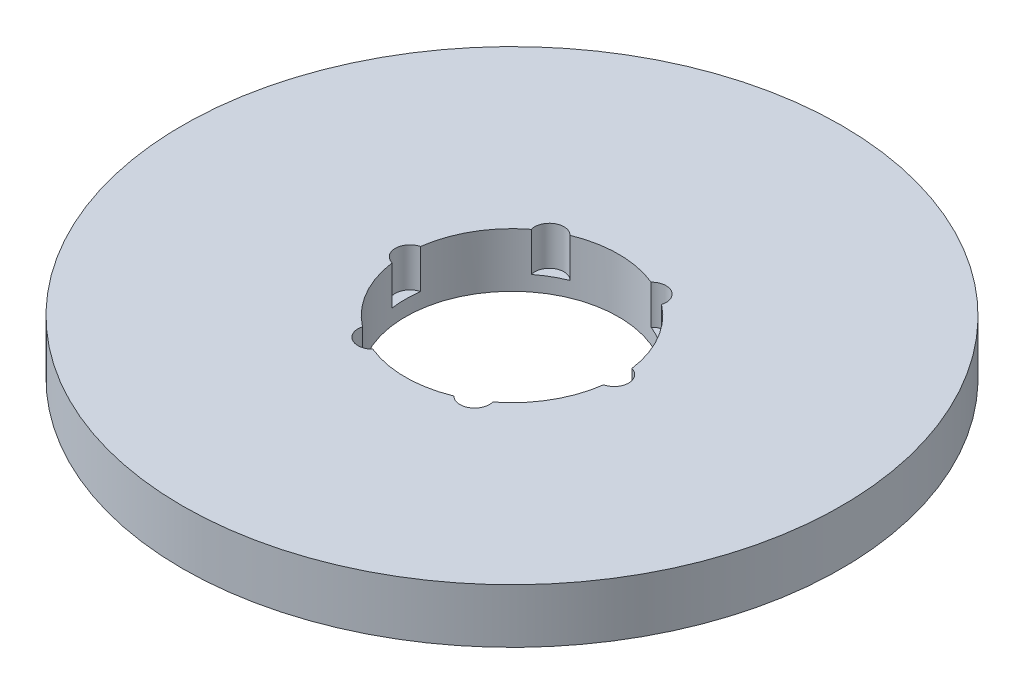
from build123d import *

# Parameters (mm, degrees)
SKETCH1_R           = 85
BOSS_EXTRUDE1_DEPTH = 14
SKETCH2_R           = 27.5
CUT_EXTRUDE1_DEPTH  = 122.020659393
SKETCH3_R           = 3.771818067
CUT_EXTRUDE2_DEPTH  = 10.071659426
CIRPATTERN1_COUNT   = 6


with BuildPart() as part:
    # Sketch1 → Boss-Extrude1 (new body)
    with BuildSketch(Plane(origin=(0, 0, 0), x_dir=(1, 0, 0), z_dir=(0, 1, 0))):
        Circle(SKETCH1_R)
    extrude(amount=BOSS_EXTRUDE1_DEPTH)

    # Sketch2 → Cut-Extrude1 (cut, through all)
    with BuildSketch(Plane(origin=(0, 0, 0), x_dir=(1, 0, 0), z_dir=(0, 1, 0))):
        Circle(SKETCH2_R)
    extrude(amount=CUT_EXTRUDE1_DEPTH, mode=Mode.SUBTRACT)

    # Sketch3 → Cut-Extrude2 (cut)
    with BuildSketch(Plane(origin=(0, 14, 0), x_dir=(1, 0, 0), z_dir=(0, 1, 0))):
        with Locations((-26.324783826, 0)):
            Circle(SKETCH3_R)
    cut_extrude2 = extrude(amount=-CUT_EXTRUDE2_DEPTH, mode=Mode.SUBTRACT)

    # CirPattern1: Cut-Extrude2 ×6 about axis
    cirpattern1_axis = Axis((0, 0, 0), (0, 1, 0))
    for i in range(1, CIRPATTERN1_COUNT):
        add(cut_extrude2.rotate(cirpattern1_axis, i * 360 / CIRPATTERN1_COUNT), mode=Mode.SUBTRACT)


solid = part.part
